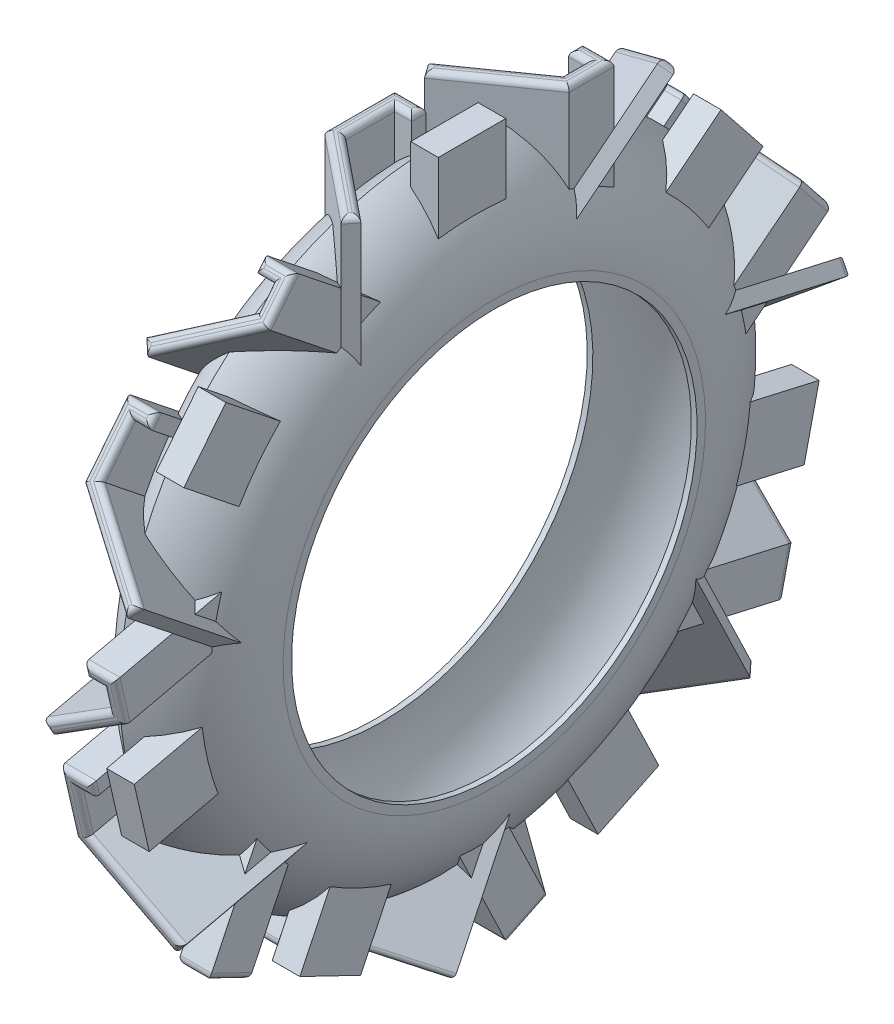
from build123d import *

# Parameters (mm, degrees)
THICKEN1_T2                    = 15
BOSS_EXTRUDE1_REACH            = 1954.033
BOSS_EXTRUDE1_END_MAJOR_RADIUS = 562.5
BOSS_EXTRUDE1_END_MINOR_RADIUS = 323.214285714
SKETCH2_W                      = 73.551100196
SKETCH2_H                      = 179.633194643
BOSS_EXTRUDE2_REACH            = 1954.033
CIRPATTERN4_COUNT              = 7
FILLET6_R                      = 15


with BuildPart() as body_1:
    # Surface-Revolve1: a surface, the sketch's curves turned about an axis
    with BuildLine(Plane.XY, mode=Mode.PRIVATE) as surface_revolve1_1_path:
        Line((157.5, 540), (157.5, 562.5))
        ThreePointArc((157.5, 562.5), (115.380626175, 722.040355396), (0, 840))
        ThreePointArc((0, 840), (-115.380626175, 722.040355396), (-157.5, 562.5))
    surface_revolve1_1 = Shell.revolve(surface_revolve1_1_path.wire(), 360, Axis((377.800417491, 0, 0), (-1, 0, 0)))
    add(Solid.thicken(surface_revolve1_1, -THICKEN1_T2))

    # Boss-Extrude1: up to this torus (the profile starts outside it)
    boss_extrude1_end = Plane(origin=(-165.714285714, 0, 0), z_dir=(-1, 0, 0)) * Torus(BOSS_EXTRUDE1_END_MAJOR_RADIUS, BOSS_EXTRUDE1_END_MINOR_RADIUS, mode=Mode.PRIVATE)
    # Sketch2 → Boss-Extrude1 (add, up to the surface)
    with BuildSketch(Plane(origin=(0, 915, 0), x_dir=(-1, 0, 0), z_dir=(0, -1, 0)), mode=Mode.PRIVATE) as boss_extrude1_sk1:
        Polygon((24.880663876, 0), (107.816210129, 0), (107.816210129, -185.775623608), (-117.76847568, -368.233825365), (-141.351072534, -339.077160164), (70.316210129, -167.87568154), (70.316210129, -37.5), (24.880663876, -37.5), align=None)
    boss_extrude1_tool1 = extrude(boss_extrude1_sk1.sketch, amount=BOSS_EXTRUDE1_REACH, mode=Mode.PRIVATE) - boss_extrude1_end
    # Sketch2 → Boss-Extrude1 (add, up to the surface)
    with BuildSketch(Plane(origin=(0, 915, 0), x_dir=(-1, 0, 0), z_dir=(0, -1, 0)), mode=Mode.PRIVATE) as boss_extrude1_sk2:
        Polygon((-34.832929426, 358.281559815), (-117.76847568, 358.281559815), (-117.76847568, 238.85437321), (107.816210129, 79.618124403), (129.441830039, 110.254419276), (-80.26847568, 258.285223313), (-80.26847568, 320.781559815), (-34.832929426, 320.781559815), align=None)
    boss_extrude1_tool2 = extrude(boss_extrude1_sk2.sketch, amount=BOSS_EXTRUDE1_REACH, mode=Mode.PRIVATE) - boss_extrude1_end
    # Sketch2 → Boss-Extrude1 (add, up to the surface)
    with BuildSketch(Plane(origin=(0, 915, 0), x_dir=(-1, 0, 0), z_dir=(0, -1, 0)), mode=Mode.PRIVATE) as boss_extrude1_sk3:
        with Locations((-71.608479524, -10.198472918)):
            Rectangle(SKETCH2_W, SKETCH2_H)
    boss_extrude1_tool3 = extrude(boss_extrude1_sk3.sketch, amount=BOSS_EXTRUDE1_REACH, mode=Mode.PRIVATE) - boss_extrude1_end
    boss_extrude1 = boss_extrude1_tool1.solids().sort_by_distance((-66.348437, 915, 4.446127))[0] + boss_extrude1_tool2.solids().sort_by_distance((76.300703, 915, -354.556426))[0] + boss_extrude1_tool3.solids().sort_by_distance((71.60848, 915, 10.198473))[0]
    add(boss_extrude1)

    # Sketch3 → Boss-Extrude2 (add, up to next)
    with BuildSketch(Plane(origin=(0, 915, 0), x_dir=(-1, 0, 0), z_dir=(0, -1, 0)), mode=Mode.PRIVATE) as boss_extrude2_sk1:
        Polygon((24.880663876, -37.5), (24.880663876, 0), (107.816210129, 0), (107.816210129, -185.775623608), (-117.76847568, -368.233825365), (-141.351072534, -339.077160164), (70.316210129, -167.87568154), (70.316210129, -37.5), align=None)
    boss_extrude2_tool1 = extrude(boss_extrude2_sk1.sketch, amount=BOSS_EXTRUDE2_REACH, mode=Mode.PRIVATE) - body_1.part
    # Sketch3 → Boss-Extrude2 (add, up to next)
    with BuildSketch(Plane(origin=(0, 915, 0), x_dir=(-1, 0, 0), z_dir=(0, -1, 0)), mode=Mode.PRIVATE) as boss_extrude2_sk2:
        Polygon((-34.832929426, 358.281559815), (-34.832929426, 320.781559815), (-80.26847568, 320.781559815), (-80.26847568, 258.285223313), (129.441830039, 110.254419276), (107.816210129, 79.618124403), (-117.76847568, 238.85437321), (-117.76847568, 358.281559815), align=None)
    boss_extrude2_tool2 = extrude(boss_extrude2_sk2.sketch, amount=BOSS_EXTRUDE2_REACH, mode=Mode.PRIVATE) - body_1.part
    boss_extrude2_1 = boss_extrude2_tool1.solids().sort_by_distance((-29.326791, 915, 18.75))[0]
    add(boss_extrude2_1)
    boss_extrude2_2 = boss_extrude2_tool2.solids().sort_by_distance((38.558064, 915, -339.53156))[0]
    add(boss_extrude2_2)
    boss_extrude2 = boss_extrude2_1 + boss_extrude2_2  # Boss-Extrude2 as one shape, for the pattern or mirror that repeats it

    # CirPattern4: Boss-Extrude1, Boss-Extrude2 ×7 about axis
    cirpattern4_axis = Axis((0, 0, 0), (1, 0, 0))
    add([boss_extrude1.rotate(cirpattern4_axis, i * 360 / CIRPATTERN4_COUNT) for i in range(1, CIRPATTERN4_COUNT)])
    add([boss_extrude2.rotate(cirpattern4_axis, i * 360 / CIRPATTERN4_COUNT) for i in range(1, CIRPATTERN4_COUNT)])

    # Fillet6
    fillet6_edges = [body_1.edges().sort_by_distance(p)[0] for p in [
        (35.517431202, 768.669014586, -557.335843045),
        (4.976132775, 787.064183097, -542.666185674),
        (-24.880663876, 585.152508997, -703.685372673),
        (-47.598437003, 599.811849293, -691.994938889),
        (-70.316210129, 650.777755481, -651.350984963),
        (129.559774107, 846.992166892, -494.875213348),
        (-107.816210129, 643.115784307, -657.461203082),
        (-66.348437003, 570.493168701, -715.375806458),
        (76.300702553, 290.37736565, -938.760705197),
        (117.76847568, 337.063332825, -901.52988874),
        (34.832929426, 305.036705946, -927.070271412),
        (4.976132775, 445.997256234, -814.657983675),
        (-118.629020084, 496.269002548, -774.567603777),
        (-24.58667718, 426.425221144, -830.266160826),
        (80.26847568, 344.12684795, -895.896923396),
        (57.550702553, 319.696046242, -915.379837627),
        (35.517431202, 43.514583199, -948.46284955),
        (4.976132775, 66.452983138, -953.698389649),
        (-24.880663876, -185.326756217, -896.231307158),
        (-47.598437003, -167.046857863, -900.40357467),
        (-70.316210129, -103.493412362, -914.90923388),
        (129.559774107, 141.181956623, -970.754790195),
        (-107.816210129, -113.047734141, -912.728522282),
        (-66.348437003, -203.60665457, -892.059039646),
        (-24.880663876, 915, 18.75),
        (-47.598437003, 915, 37.5),
        (76.300702553, -552.905347654, -812.333892337),
        (117.76847568, -494.688898806, -825.621416889),
        (34.832929426, -534.6254493, -816.506159849),
        (4.976132775, -358.850518163, -856.625640842),
        (-70.316210129, 915, 102.68784077),
        (-118.629020084, -296.162675865, -870.93373177),
        (-24.58667718, -383.256446723, -851.055146912),
        (80.26847568, -485.880839514, -827.631798944),
        (57.550702553, -516.345550947, -820.67842736),
        (35.517431202, -714.407216873, -625.377985228),
        (35.517431202, 915, 253.476420852),
        (4.976132775, -704.198668517, -646.576254317),
        (-24.880663876, -816.251194022, -413.896787566),
        (-47.598437003, -808.115873914, -430.789953839),
        (-70.316210129, -779.831929816, -489.522168938),
        (129.559774107, -670.94114657, -715.636210236),
        (-107.816210129, -784.084003027, -480.692647935),
        (-66.348437003, -824.386514131, -397.003621293),
        (129.559774107, 915, 353.655492765),
        (4.976132775, 915, 277.004724487),
        (-107.816210129, 915, 92.887811804),
        (-66.348437003, 915, 0),
        (76.300702553, -979.83905696, -74.203089956),
        (117.76847568, -953.930299822, -128.003178512),
        (34.832929426, -971.703736852, -91.096256229),
        (4.976132775, -893.476533166, -253.536718476),
        (-118.629020084, -865.577818734, -311.46899593),
        (-24.58667718, -904.3381932, -230.982249012),
        (80.26847568, -950.010344662, -136.143049275),
        (57.550702553, -963.568416743, -107.989422502),
        (35.517431202, -934.365811388, 168.629257357),
        (4.976132775, -944.574359744, 147.430988268),
        (-24.880663876, -832.521834239, 380.110455019),
        (-47.598437003, -840.657154348, 363.217288746),
        (-70.316210129, -868.941098446, 304.485073647),
        (129.559774107, -977.831881691, 78.371032349),
        (-107.816210129, -864.689025235, 313.31459465),
        (-66.348437003, -824.386514131, 397.003621293),
        (76.300702553, -668.933971301, 719.804152629),
        (117.76847568, -694.84272844, 666.004064073),
        (34.832929426, -677.06929141, 702.910986356),
        (4.976132775, -755.296495095, 540.470524109),
        (-118.629020084, -783.195209527, 482.538246655),
        (-24.58667718, -744.434835061, 563.024993573),
        (80.26847568, -698.7626836, 657.86419331),
        (57.550702553, -685.204611518, 686.017820083),
        (35.517431202, -450.727892339, 835.655229742),
        (4.976132775, -473.666292278, 830.419689643),
        (-24.880663876, -221.886552923, 887.886772135),
        (-47.598437003, -240.166451277, 883.714504623),
        (-70.316210129, -303.719896778, 869.208845412),
        (129.559774107, -548.395265763, 813.363289098),
        (-107.816210129, -294.165574999, 871.389557011),
        (-66.348437003, -203.60665457, 892.059039646),
        (76.300702553, 145.692038514, 971.784186956),
        (117.76847568, 87.475589666, 958.496662404),
        (34.832929426, 127.41214016, 967.611919444),
        (4.976132775, -48.362790977, 927.492438451),
        (-118.629020084, -111.050633275, 913.184347522),
        (-24.58667718, -23.956862417, 933.062932381),
        (80.26847568, 78.667530374, 956.486280349),
        (57.550702553, 109.132241807, 963.439651932),
        (35.517431202, 372.317322815, 873.415769871),
        (4.976132775, 353.922154305, 888.085427242),
        (-24.880663876, 555.833828404, 727.066240243),
        (-47.598437003, 541.174488108, 738.756674028),
        (-70.316210129, 490.20858192, 779.400627953),
        (129.559774107, 293.994170509, 935.876399568),
        (-107.816210129, 497.870553095, 773.290409835),
        (-66.348437003, 570.493168701, 715.375806458),
        (34.832929426, 915, -339.531559815),
        (76.300702553, 915, -358.281559815),
        (117.76847568, 915, -298.567966512),
        (4.976132775, 915, -159.236248807),
        (-118.629020084, 915, -94.93627184),
        (76.300702553, 850.608971752, 491.99090772),
        (117.76847568, 803.923004577, 529.221724176),
        (34.832929426, 835.949631456, 503.681341504),
        (-24.58667718, 915, -184.269821294),
        (4.976132775, 694.989081168, 616.093629241),
        (-118.629020084, 644.717334853, 656.18400914),
        (-24.58667718, 714.561116257, 600.485452091),
        (80.26847568, 796.859489451, 534.854689521),
        (57.550702553, 821.290291159, 515.371775289),
        (80.26847568, 915, -289.533391564),
        (57.550702553, 915, -320.781559815),
    ]]
    fillet(fillet6_edges, radius=FILLET6_R)


solid = body_1.part
